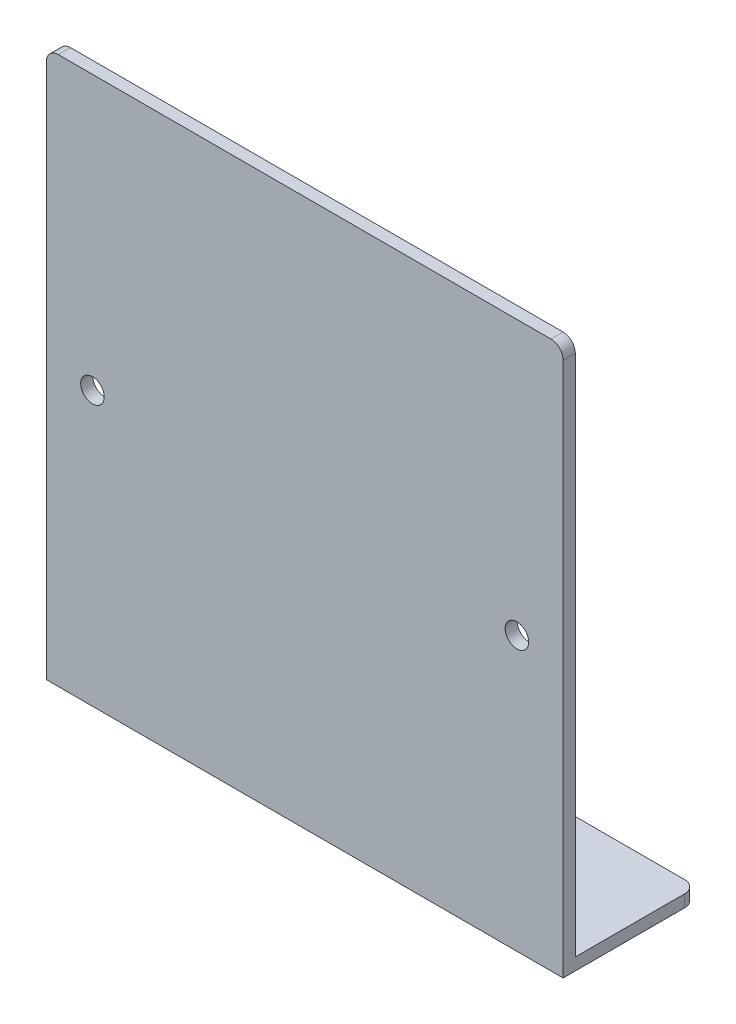
from build123d import *

# Parameters (mm, degrees)
SKETCH1_W                        = 107.95
SKETCH1_H                        = 25.4
BOSS_EXTRUDE2_DEPTH              = 2.54
F_10_0_1935_DIAMETER_HOLE1_D     = 4.9149
F_10_0_1935_DIAMETER_HOLE1_DEPTH = 25.4
F_10_0_1935_DIAMETER_HOLE1_TIP   = 1.476584928
SKETCH9_W                        = 107.95
SKETCH9_H                        = 114.3
BOSS_EXTRUDE3_DEPTH              = 2.54
F_10_0_1935_DIAMETER_HOLE2_D     = 4.9149
F_10_0_1935_DIAMETER_HOLE2_DEPTH = 25.4
F_10_0_1935_DIAMETER_HOLE2_TIP   = 1.476584928
FILLET2_R                        = 2.54
FILLET3_R                        = 2.54
FILLET4_R                        = 2.54
FILLET5_R                        = 2.54


with BuildPart() as part:
    # Sketch1 → Boss-Extrude2 (new body)
    with BuildSketch(Plane(origin=(0, 0, 0), x_dir=(1, 0, 0), z_dir=(0, 1, 0))):
        with Locations((53.975, 12.7)):
            Rectangle(SKETCH1_W, SKETCH1_H)
    extrude(amount=BOSS_EXTRUDE2_DEPTH)

    # #10 (0.1935) Diameter Hole1
    with Locations(Plane(origin=(0, 2.54, 0), x_dir=(1, 0, 0), z_dir=(0, 1, 0))):
        with Locations((25.4, 12.7), (82.55, 12.7)):
            Hole(F_10_0_1935_DIAMETER_HOLE1_D / 2, depth=F_10_0_1935_DIAMETER_HOLE1_DEPTH)
            with Locations((0, 0, -(F_10_0_1935_DIAMETER_HOLE1_DEPTH + F_10_0_1935_DIAMETER_HOLE1_TIP / 2))):  # 118° drill point
                Cone(0, F_10_0_1935_DIAMETER_HOLE1_D / 2, F_10_0_1935_DIAMETER_HOLE1_TIP, mode=Mode.SUBTRACT)

    # Sketch9 → Boss-Extrude3 (add)
    with BuildSketch(Plane.XY):
        with Locations((53.975, 57.15)):
            Rectangle(SKETCH9_W, SKETCH9_H)
    extrude(amount=BOSS_EXTRUDE3_DEPTH)

    # #10 (0.1935) Diameter Hole2
    with Locations(Plane(origin=(9.652, 57.15, 2.54), x_dir=(1, 0, 0), z_dir=(0, 0, 1))):
        with Locations((0, 0), (88.646, 0)):
            Hole(F_10_0_1935_DIAMETER_HOLE2_D / 2, depth=F_10_0_1935_DIAMETER_HOLE2_DEPTH)
            with Locations((0, 0, -(F_10_0_1935_DIAMETER_HOLE2_DEPTH + F_10_0_1935_DIAMETER_HOLE2_TIP / 2))):  # 118° drill point
                Cone(0, F_10_0_1935_DIAMETER_HOLE2_D / 2, F_10_0_1935_DIAMETER_HOLE2_TIP, mode=Mode.SUBTRACT)

    # Fillet2
    fillet2_edges = [part.edges().sort_by_distance(p)[0] for p in [
        (107.95, 114.3, 1.27),
    ]]
    fillet(fillet2_edges, radius=FILLET2_R)

    # Fillet3
    fillet3_edges = [part.edges().sort_by_distance(p)[0] for p in [
        (0, 114.3, 1.27),
    ]]
    fillet(fillet3_edges, radius=FILLET3_R)

    # Fillet4
    fillet4_edges = [part.edges().sort_by_distance(p)[0] for p in [
        (107.95, 1.27, -25.4),
    ]]
    fillet(fillet4_edges, radius=FILLET4_R)

    # Fillet5
    fillet5_edges = [part.edges().sort_by_distance(p)[0] for p in [
        (0, 1.27, -25.4),
    ]]
    fillet(fillet5_edges, radius=FILLET5_R)


solid = part.part
